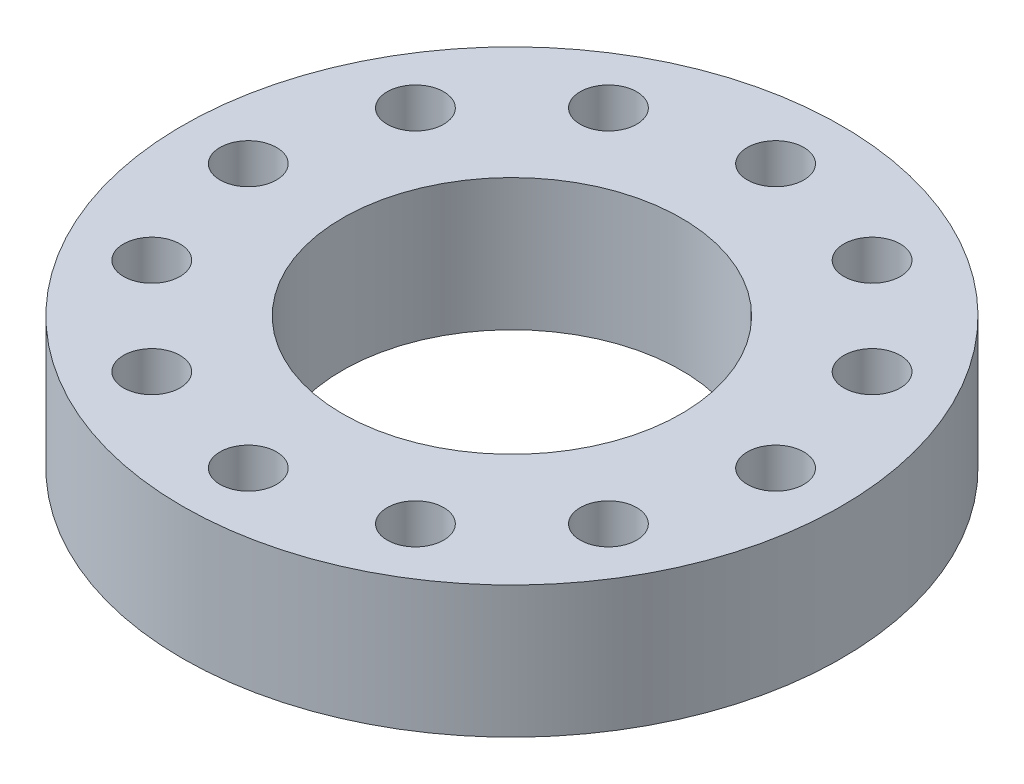
from build123d import *

# Parameters (mm, degrees)
SKETCH1_R           = 17.5
SKETCH1_R_2         = 9
SKETCH1_R_3         = 1.5
BOSS_EXTRUDE1_DEPTH = 7


with BuildPart() as part:
    # Sketch1 → Boss-Extrude1 (new body)
    with BuildSketch(Plane(origin=(0, 0, 0), x_dir=(1, 0, 0), z_dir=(0, 1, 0))):
        Circle(SKETCH1_R)
        Circle(SKETCH1_R_2, mode=Mode.SUBTRACT)
        with Locations((0, 14)):
            Circle(SKETCH1_R_3, mode=Mode.SUBTRACT)
        with Locations((7, 12.124355653)):
            Circle(SKETCH1_R_3, mode=Mode.SUBTRACT)
        with Locations((12.124355653, 7)):
            Circle(SKETCH1_R_3, mode=Mode.SUBTRACT)
        with Locations((14, 0)):
            Circle(SKETCH1_R_3, mode=Mode.SUBTRACT)
        with Locations((12.124355653, -7)):
            Circle(SKETCH1_R_3, mode=Mode.SUBTRACT)
        with Locations((7, -12.124355653)):
            Circle(SKETCH1_R_3, mode=Mode.SUBTRACT)
        with Locations((0, -14)):
            Circle(SKETCH1_R_3, mode=Mode.SUBTRACT)
        with Locations((-7, -12.124355653)):
            Circle(SKETCH1_R_3, mode=Mode.SUBTRACT)
        with Locations((-12.124355653, -7)):
            Circle(SKETCH1_R_3, mode=Mode.SUBTRACT)
        with Locations((-14, 0)):
            Circle(SKETCH1_R_3, mode=Mode.SUBTRACT)
        with Locations((-12.124355653, 7)):
            Circle(SKETCH1_R_3, mode=Mode.SUBTRACT)
        with Locations((-7, 12.124355653)):
            Circle(SKETCH1_R_3, mode=Mode.SUBTRACT)
    extrude(amount=BOSS_EXTRUDE1_DEPTH)


solid = part.part
